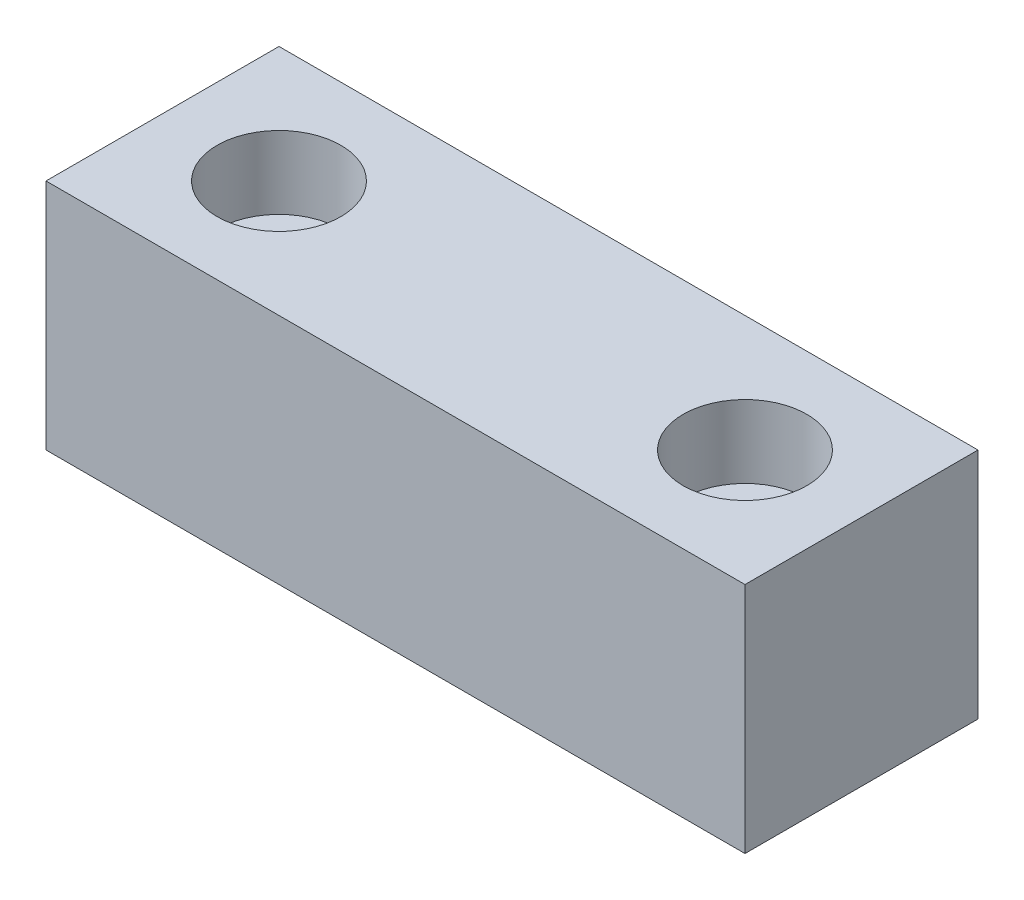
from build123d import *

# Parameters (mm, degrees)
SKETCH1_W           = 76.2
SKETCH1_H           = 25.4
BOSS_EXTRUDE1_DEPTH = 12.7
CUT_EXTRUDE2_START  = 12.7
SKETCH2_R           = 4.3688
CUT_EXTRUDE2_DEPTH  = 76.2
CUT_EXTRUDE4_START  = 12.7
SKETCH3_R           = 6.7437
CUT_EXTRUDE4_DEPTH  = 7.9248


with BuildPart() as part:
    # Sketch1 → Boss-Extrude1 (new, symmetric)
    with BuildSketch(Plane(origin=(0, 0, 0), x_dir=(1, 0, 0), z_dir=(0, 1, 0))):
        Rectangle(SKETCH1_W, SKETCH1_H)
    extrude(amount=BOSS_EXTRUDE1_DEPTH, both=True)

    # Sketch2 → Cut-Extrude2 (cut)
    with BuildSketch(Plane(origin=(0, 0, 0), x_dir=(1, 0, 0), z_dir=(0, 1, 0)).offset(CUT_EXTRUDE2_START)):
        with Locations((-25.4, 0)):
            Circle(SKETCH2_R)
        with Locations((25.4, 0)):
            Circle(SKETCH2_R)
    extrude(amount=-CUT_EXTRUDE2_DEPTH, mode=Mode.SUBTRACT)

    # Sketch3 → Cut-Extrude4 (cut)
    with BuildSketch(Plane(origin=(0, 0, 0), x_dir=(1, 0, 0), z_dir=(0, 1, 0)).offset(CUT_EXTRUDE4_START)):
        with Locations((-25.4, 0)):
            Circle(SKETCH3_R)
        with Locations((25.4, 0)):
            Circle(SKETCH3_R)
    extrude(amount=-CUT_EXTRUDE4_DEPTH, mode=Mode.SUBTRACT)


solid = part.part
